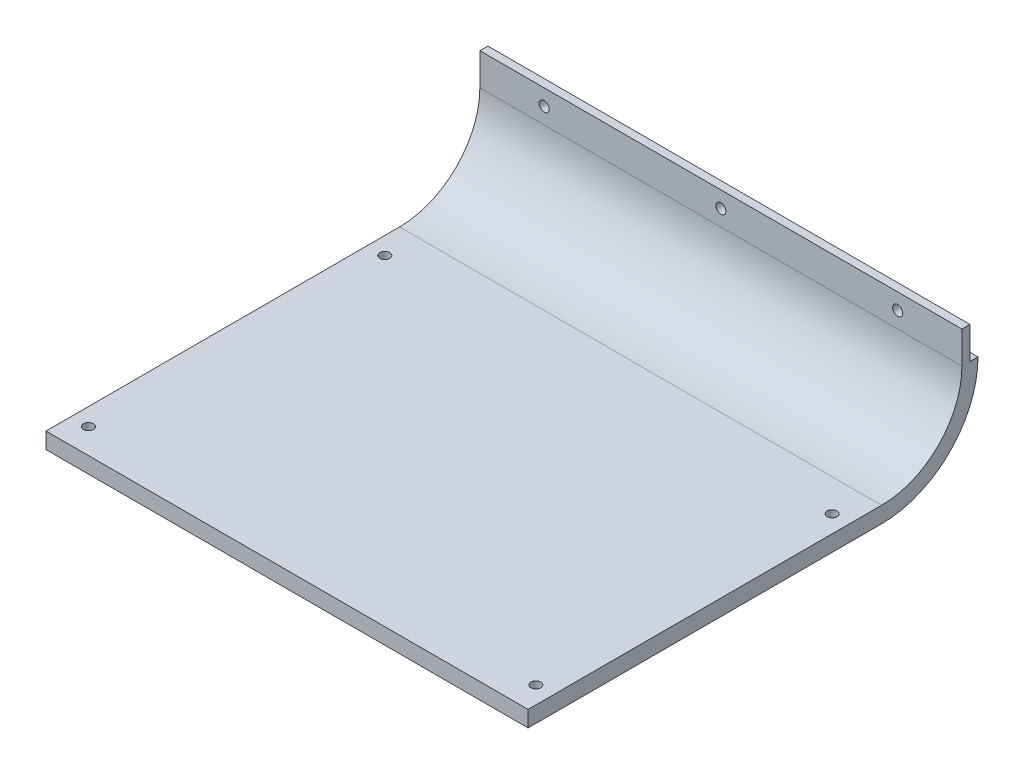
from build123d import *

# Parameters (mm, degrees)
BOSS_EXTRUDE1_DEPTH      = 190.5
BOSS_EXTRUDE1_DEPTH_BACK = 190.5
SKETCH2_W                = 381
SKETCH2_H                = 6.35
BOSS_EXTRUDE2_DEPTH      = 25.4
SKETCH3_R                = 3.96875
CUT_EXTRUDE1_DEPTH       = 25.4
SKETCH4_R                = 3.937
CUT_EXTRUDE2_DEPTH       = 302.34078715


with BuildPart() as part:
    # Sketch1 → Boss-Extrude1 (new, two sides: drawn at the far end of the back side and taken through both)
    with BuildSketch(Plane(origin=(0, 0, 0), x_dir=(0, 0, -1), z_dir=(1, 0, 0)).offset(-BOSS_EXTRUDE1_DEPTH_BACK)):
        with BuildLine():
            Line((-139.7, 0), (139.7, 0))
            ThreePointArc((139.7, 0), (193.581536726, 22.318463274), (215.9, 76.2))
            Line((215.9, 76.2), (203.2, 76.2))
            ThreePointArc((203.2, 76.2), (184.601280605, 31.298719395), (139.7, 12.7))
            Line((139.7, 12.7), (-139.7, 12.7))
            Line((-139.7, 12.7), (-139.7, 0))
        make_face()
    extrude(amount=BOSS_EXTRUDE1_DEPTH + BOSS_EXTRUDE1_DEPTH_BACK)

    # Sketch2 → Boss-Extrude2 (add)
    with BuildSketch(Plane(origin=(0, 76.2, 0), x_dir=(1, 0, 0), z_dir=(0, 1, 0))):
        with Locations((0, 206.375)):
            Rectangle(SKETCH2_W, SKETCH2_H)
    extrude(amount=BOSS_EXTRUDE2_DEPTH)

    # Sketch3 → Cut-Extrude1 (cut)
    with BuildSketch(Plane(origin=(0, 0, -209.55), x_dir=(-1, 0, 0), z_dir=(0, 0, -1))):
        with Locations((-139.7, 88.9)):
            Circle(SKETCH3_R)
        with Locations((139.7, 88.9)):
            Circle(SKETCH3_R)
        with Locations((0, 88.9)):
            Circle(SKETCH3_R)
    extrude(amount=-CUT_EXTRUDE1_DEPTH, mode=Mode.SUBTRACT)

    # Sketch4 → Cut-Extrude2 (cut, through all)
    with BuildSketch(Plane(origin=(0, 12.7, 0), x_dir=(1, 0, 0), z_dir=(0, 1, 0))):
        with Locations((176.784, -119.888)):
            Circle(SKETCH4_R)
        with Locations((176.784, 114.3)):
            Circle(SKETCH4_R)
        with Locations((-176.784, -119.888)):
            Circle(SKETCH4_R)
        with Locations((-176.784, 114.3)):
            Circle(SKETCH4_R)
    extrude(amount=-CUT_EXTRUDE2_DEPTH, mode=Mode.SUBTRACT)


solid = part.part
